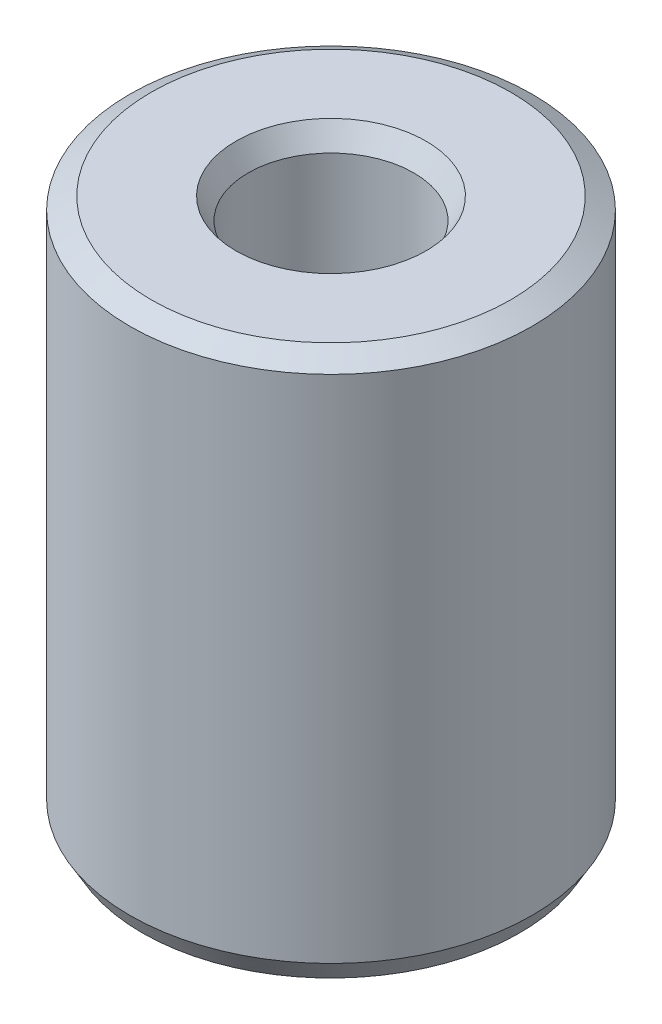
from build123d import *
from OCP.BRepFilletAPI import BRepFilletAPI_MakeChamfer

# Parameters (mm, degrees)
SKETCH1_R           = 55
BOSS_EXTRUDE1_DEPTH = 148.714564405
SKETCH2_R           = 22.637355602
CUT_EXTRUDE1_DEPTH  = 168.827356728
CHAMFER1_SIZE       = 3.365841287
CHAMFER1_SIZE2      = 5.82980812


with BuildPart() as part:
    # Sketch1 → Boss-Extrude1 (new body)
    with BuildSketch(Plane(origin=(0, 0, 0), x_dir=(1, 0, 0), z_dir=(0, 1, 0))):
        Circle(SKETCH1_R)
    extrude(amount=BOSS_EXTRUDE1_DEPTH)

    # Sketch2 → Cut-Extrude1 (cut, through all)
    with BuildSketch(Plane(origin=(0, 0, 0), x_dir=(1, 0, 0), z_dir=(0, 1, 0))):
        Circle(SKETCH2_R)
    extrude(amount=CUT_EXTRUDE1_DEPTH, mode=Mode.SUBTRACT)

    # Chamfer1: one chamfer whose edges measure the first distance from different faces: ONE call of the kernel's chamfer builder (chamfer() names one face for all edges)
    chamfer1_edges_1 = [part.edges().sort_by_distance(p)[0] for p in [
        (-22.637355602, 148.714564405, 0),
    ]]
    chamfer1_side_1 = [part.faces().sort_by_distance(p)[0] for p in [
        (-53.444365081, 148.714564405, 0),
    ]]
    chamfer1_edges_2 = [part.edges().sort_by_distance(p)[0] for p in [
        (-22.637355602, 0, 0),
    ]]
    chamfer1_side_2 = [part.faces().sort_by_distance(p)[0] for p in [
        (-22.637355602, 74.357282202, 0),
    ]]
    chamfer1_edges_3 = [part.edges().sort_by_distance(p)[0] for p in [
        (-55, 0, 0),
    ]]
    chamfer1_side_3 = [part.faces().sort_by_distance(p)[0] for p in [
        (-53.444365081, 0, 0),
    ]]
    chamfer1_edges_4 = [part.edges().sort_by_distance(p)[0] for p in [
        (-55, 148.714564405, 0),
    ]]
    chamfer1_side_4 = [part.faces().sort_by_distance(p)[0] for p in [
        (-55, 74.357282202, 0),
    ]]
    chamfer1 = BRepFilletAPI_MakeChamfer(part.part.solid().wrapped)
    for e in chamfer1_edges_1:
        chamfer1.Add(CHAMFER1_SIZE, CHAMFER1_SIZE2, e.wrapped, chamfer1_side_1[0].wrapped)  # the first distance lies on this face
    for e in chamfer1_edges_2:
        chamfer1.Add(CHAMFER1_SIZE, CHAMFER1_SIZE2, e.wrapped, chamfer1_side_2[0].wrapped)  # the first distance lies on this face
    for e in chamfer1_edges_3:
        chamfer1.Add(CHAMFER1_SIZE, CHAMFER1_SIZE2, e.wrapped, chamfer1_side_3[0].wrapped)  # the first distance lies on this face
    for e in chamfer1_edges_4:
        chamfer1.Add(CHAMFER1_SIZE, CHAMFER1_SIZE2, e.wrapped, chamfer1_side_4[0].wrapped)  # the first distance lies on this face
    add(Compound.cast(chamfer1.Shape()), mode=Mode.REPLACE)


solid = part.part
